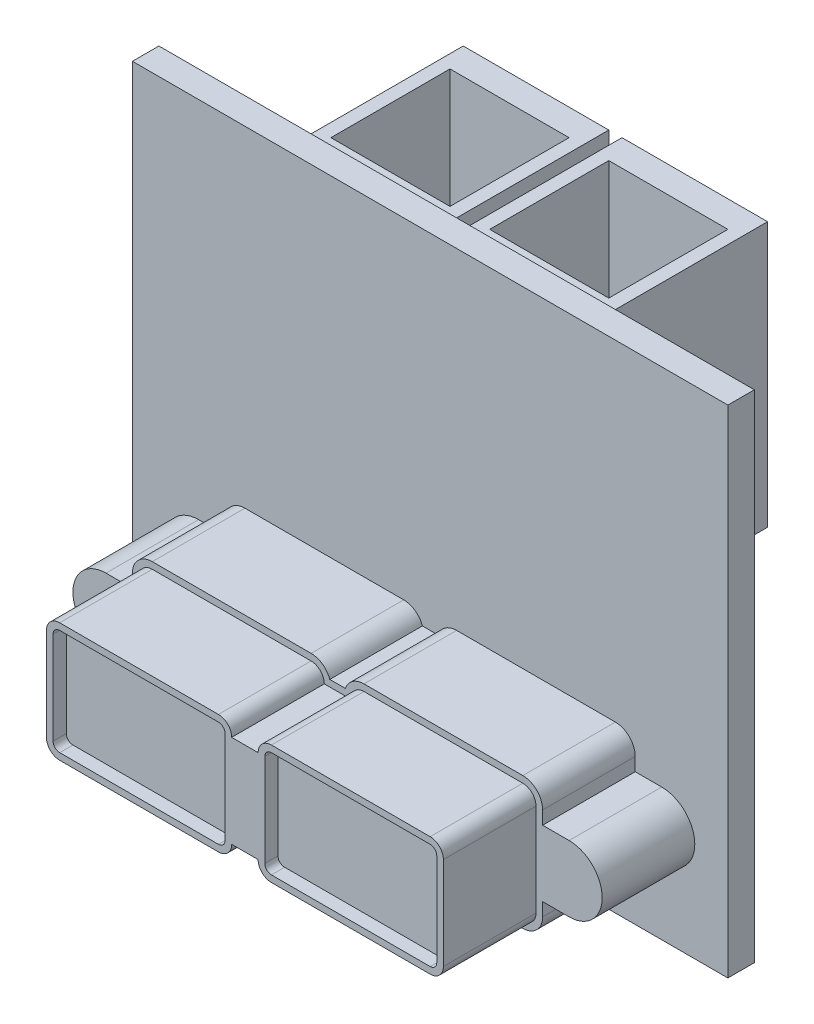
from build123d import *

# Parameters (mm, degrees)
SKETCH1_W           = 45
SKETCH1_H           = 37.5
BOSS_EXTRUDE1_DEPTH = 2
SKETCH2_W           = 40
SKETCH2_H           = 13
BOSS_EXTRUDE2_DEPTH = 7
BOSS_EXTRUDE3_DEPTH = 7
FILLET1_R           = 1
CUT_EXTRUDE1_DEPTH  = 1
SKETCH5_W           = 41
SKETCH5_H           = 14
CUT_EXTRUDE2_DEPTH  = 7
SKETCH6_W           = 11
SKETCH6_H           = 20
BOSS_EXTRUDE5_DEPTH = 12
SKETCH7_W           = 9
SKETCH7_H           = 9
CUT_EXTRUDE3_DEPTH  = 12


with BuildPart() as part:
    # Sketch1 → Boss-Extrude1 (new body)
    with BuildSketch(Plane.XY):
        Rectangle(SKETCH1_W, SKETCH1_H)
    extrude(amount=BOSS_EXTRUDE1_DEPTH)

    # Sketch2 → Boss-Extrude2 (add)
    with BuildSketch(Plane.XY.offset(2)):
        with Locations((0, -11.25)):
            Rectangle(SKETCH2_W, SKETCH2_H)
    extrude(amount=BOSS_EXTRUDE2_DEPTH)

    # Sketch3 → Boss-Extrude3 (add)
    with BuildSketch(Plane.XY.offset(9)):
        Polygon((-1, -7.75), (-1, -6.75), (-15, -6.75), (-15, -15.75), (-1, -15.75), (-1, -14.75), (1, -14.75), (1, -15.75), (15, -15.75), (15, -6.75), (1, -6.75), (1, -7.75), align=None)
    extrude(amount=BOSS_EXTRUDE3_DEPTH)

    # Fillet1
    fillet1_edges = [part.edges().sort_by_distance(p)[0] for p in [
        (-15, -15.75, 12.5),
        (-1, -15.75, 12.5),
        (1, -15.75, 12.5),
        (-15, -6.75, 12.5),
        (15, -15.75, 12.5),
        (15, -6.75, 12.5),
        (1, -6.75, 12.5),
        (-1, -6.75, 12.5),
    ]]
    fillet(fillet1_edges, radius=FILLET1_R - 0.0001)  # a hair under: the kernel refuses the full size

    # Sketch4 → Cut-Extrude1 (cut)
    with BuildSketch(Plane.XY.offset(16)):
        with BuildLine():
            Line((-1.5, -14.75), (-1.5, -7.75))
            ThreePointArc((-1.5, -7.75), (-1.646446609, -7.396446609), (-2, -7.25))
            Line((-2, -7.25), (-14, -7.25))
            ThreePointArc((-14, -7.25), (-14.353553391, -7.396446609), (-14.5, -7.75))
            Line((-14.5, -7.75), (-14.5, -14.75))
            ThreePointArc((-14.5, -14.75), (-14.353553391, -15.103553391), (-14, -15.25))
            Line((-14, -15.25), (-2, -15.25))
            ThreePointArc((-2, -15.25), (-1.646446609, -15.103553391), (-1.5, -14.75))
        make_face()
        with BuildLine():
            Line((1.5, -7.75), (1.5, -14.75))
            ThreePointArc((1.5, -14.75), (1.646446609, -15.103553391), (2, -15.25))
            Line((2, -15.25), (14, -15.25))
            ThreePointArc((14, -15.25), (14.353553391, -15.103553391), (14.5, -14.75))
            Line((14.5, -14.75), (14.5, -7.75))
            ThreePointArc((14.5, -7.75), (14.353553391, -7.396446609), (14, -7.25))
            Line((14, -7.25), (2, -7.25))
            ThreePointArc((2, -7.25), (1.646446609, -7.396446609), (1.5, -7.75))
        make_face()
    extrude(amount=-CUT_EXTRUDE1_DEPTH, mode=Mode.SUBTRACT)

    # Sketch5 → Cut-Extrude2 (cut)
    with BuildSketch(Plane.XY.offset(9)):
        with Locations((0, -11.25)):
            Rectangle(SKETCH5_W, SKETCH5_H)
        with BuildLine():
            Line((-17.5, -8.75), (-15.5, -8.75))
            Line((-15.5, -8.75), (-15.5, -7.75))
            ThreePointArc((-15.5, -7.75), (-15.060660172, -6.689339828), (-14, -6.25))
            Line((-14, -6.25), (-2, -6.25))
            ThreePointArc((-2, -6.25), (-1.133974596, -6.525255129), (-0.585786438, -7.25))
            Line((-0.585786438, -7.25), (0.585786438, -7.25))
            ThreePointArc((0.585786438, -7.25), (1.133974596, -6.525255129), (2, -6.25))
            Line((2, -6.25), (14, -6.25))
            ThreePointArc((14, -6.25), (15.060660172, -6.689339828), (15.5, -7.75))
            Line((15.5, -7.75), (15.5, -8.75))
            Line((15.5, -8.75), (17.5, -8.75))
            ThreePointArc((17.5, -8.75), (20, -11.25), (17.5, -13.75))
            Line((17.5, -13.75), (15.5, -13.75))
            Line((15.5, -13.75), (15.5, -14.75))
            ThreePointArc((15.5, -14.75), (15.060660172, -15.810660172), (14, -16.25))
            Line((14, -16.25), (2, -16.25))
            ThreePointArc((2, -16.25), (1.133974596, -15.974744871), (0.585786438, -15.25))
            Line((0.585786438, -15.25), (-0.585786438, -15.25))
            ThreePointArc((-0.585786438, -15.25), (-1.133974596, -15.974744871), (-2, -16.25))
            Line((-2, -16.25), (-14, -16.25))
            ThreePointArc((-14, -16.25), (-15.060660172, -15.810660172), (-15.5, -14.75))
            Line((-15.5, -14.75), (-15.5, -13.75))
            Line((-15.5, -13.75), (-17.5, -13.75))
            ThreePointArc((-17.5, -13.75), (-20, -11.25), (-17.5, -8.75))
        make_face(mode=Mode.SUBTRACT)
    extrude(amount=-CUT_EXTRUDE2_DEPTH, mode=Mode.SUBTRACT)

    # Sketch6 → Boss-Extrude5 (add)
    with BuildSketch(Plane(origin=(0, 0, 0), x_dir=(-1, 0, 0), z_dir=(0, 0, -1))):
        with Locations((-6, 8.25)):
            Rectangle(SKETCH6_W, SKETCH6_H)
        with Locations((6, 8.25)):
            Rectangle(SKETCH6_W, SKETCH6_H)
    extrude(amount=BOSS_EXTRUDE5_DEPTH)

    # Sketch7 → Cut-Extrude3 (cut)
    with BuildSketch(Plane(origin=(0, 18.25, 0), x_dir=(1, 0, 0), z_dir=(0, 1, 0))):
        with Locations((-6, 5.5)):
            Rectangle(SKETCH7_W, SKETCH7_H)
        with Locations((6, 5.5)):
            Rectangle(SKETCH7_W, SKETCH7_H)
    extrude(amount=-CUT_EXTRUDE3_DEPTH, mode=Mode.SUBTRACT)


solid = part.part
